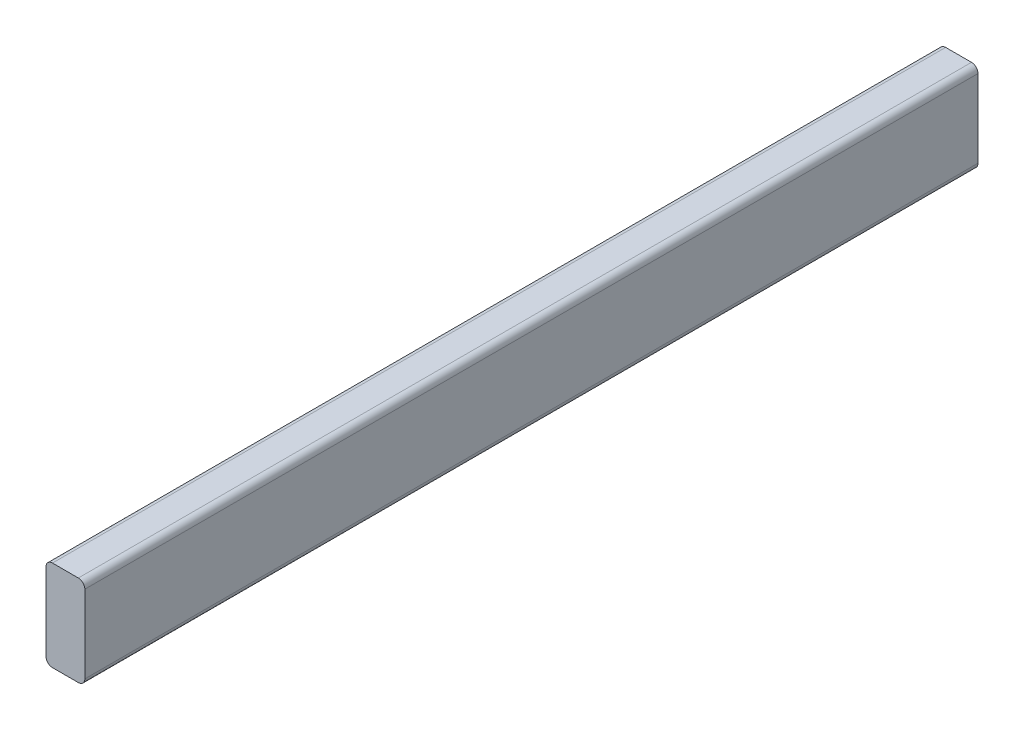
from build123d import *

# Parameters (mm, degrees)
BOSS_EXTRUDE1_DEPTH = 876.3


with BuildPart() as part:
    # Sketch2 → Boss-Extrude1 (new body)
    with BuildSketch(Plane.XY):
        with BuildLine():
            Line((-12.7, 44.45), (12.7, 44.45))
            ThreePointArc((12.7, 44.45), (17.190128061, 42.590128061), (19.05, 38.1))
            Line((19.05, 38.1), (19.05, -38.1))
            ThreePointArc((19.05, -38.1), (17.190128061, -42.590128061), (12.7, -44.45))
            Line((12.7, -44.45), (-12.7, -44.45))
            ThreePointArc((-12.7, -44.45), (-17.190128061, -42.590128061), (-19.05, -38.1))
            Line((-19.05, -38.1), (-19.05, 38.1))
            ThreePointArc((-19.05, 38.1), (-17.190128061, 42.590128061), (-12.7, 44.45))
        make_face()
    extrude(amount=BOSS_EXTRUDE1_DEPTH)


solid = part.part
